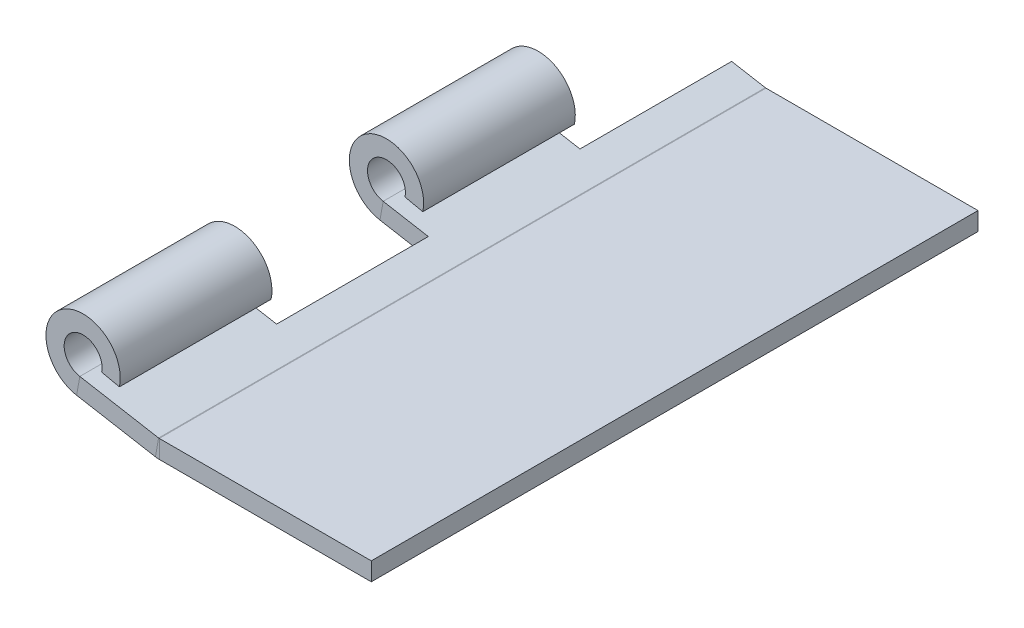
from build123d import *

# Parameters (mm, degrees)
BRIDA_BASE1_DEPTH     = 50.8
CORTAR_EXTRUIR1_START = 25.4
CORTAR_EXTRUIR1_DEPTH = 12.7
MATRIZL1_COUNT        = 2
MATRIZL1_PITCH        = 25.4


# Read off the part's stored shape, not the designer's step: Cortar-Extruir1
# Sheet-metal steps are written as plain solids
with BuildPart() as part:
    # Croquis1 → Brida base1 (new body)
    with BuildSketch(Plane.XY):
        with BuildLine():
            Line((0, 0), (-17.751111243, 0))
            ThreePointArc((-17.751111243, 0), (-17.77989007, 0.001256511), (-17.808449872, 0.00501648))
            Line((-17.808449872, 0.00501648), (-24.405666482, 1.168283766))
            ThreePointArc((-24.405666482, 1.168283766), (-25.014357108, 4.05002443), (-22.578895558, 2.393684921))
            Line((-22.578895558, 2.393684921), (-21.089835293, 2.069223014))
            ThreePointArc((-21.089835293, 2.069223014), (-25.863339932, 5.315648452), (-24.670306305, -0.33256325))
            Line((-24.670306305, -0.33256325), (-18.073089694, -1.495830536))
            ThreePointArc((-18.073089694, -1.495830536), (-17.912715421, -1.516944209), (-17.751111243, -1.524))
            Line((-17.751111243, -1.524), (0, -1.524))
            Line((0, -1.524), (0, 0))
        make_face()
    extrude(amount=BRIDA_BASE1_DEPTH)

    # Cortar-Extruir1 outline → Cortar-Extruir1 (cut)
    with BuildSketch(Plane.XY.offset(CORTAR_EXTRUIR1_START)):
        with BuildLine():
            Line((-24.670306305, -0.33256325), (-20.8915, -0.998868756))
            Line((-20.8915, -0.998868756), (-20.626860177, 0.50197826))
            Line((-20.626860177, 0.50197826), (-24.405666482, 1.168283766))
            ThreePointArc((-24.405666482, 1.168283766), (-25.014357108, 4.05002443), (-22.578895558, 2.393684921))
            Line((-22.578895558, 2.393684921), (-21.089835293, 2.069223014))
            ThreePointArc((-21.089835293, 2.069223014), (-25.863339932, 5.315648452), (-24.670306305, -0.33256325))
        make_face()
    cortar_extruir1 = extrude(amount=CORTAR_EXTRUIR1_DEPTH, mode=Mode.SUBTRACT)

    # MatrizL1: Cortar-Extruir1 ×2
    with Locations(*[(0, 0, -i * MATRIZL1_PITCH) for i in range(1, MATRIZL1_COUNT)]):
        add(cortar_extruir1, mode=Mode.SUBTRACT)


solid = part.part
